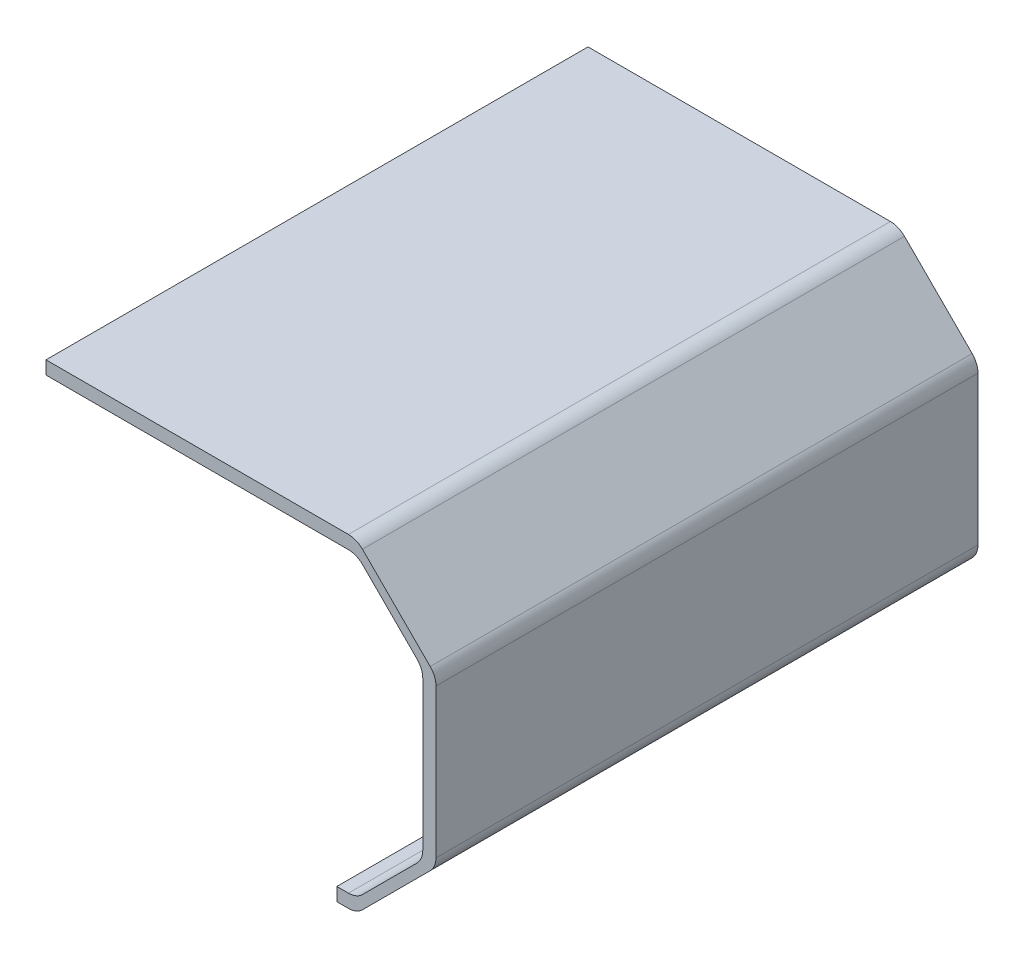
from build123d import *

# Parameters (mm, degrees)
EXTRUDE_1_DEPTH = 82
FILLET_1_R      = 3


with BuildPart() as part:
    # 草图1 → 凸台-拉伸1 (new body)
    with BuildSketch(Plane.XY):
        Polygon((0, 0), (0, 2), (3, 2), (13, 12), (13, 37), (3, 47), (-44, 47), (-44, 49), (3, 49), (15, 37), (15, 12), (3, 0), align=None)
    extrude(amount=EXTRUDE_1_DEPTH)

    # 圆角1
    fillet_1_edges = [part.edges().sort_by_distance(p)[0] for p in [
        (3, 0, 41),
        (15, 12, 41),
        (15, 37, 41),
        (3, 49, 41),
        (3, 2, 41),
        (13, 12, 41),
        (13, 37, 41),
        (3, 47, 41),
    ]]
    fillet(fillet_1_edges, radius=FILLET_1_R)


solid = part.part
